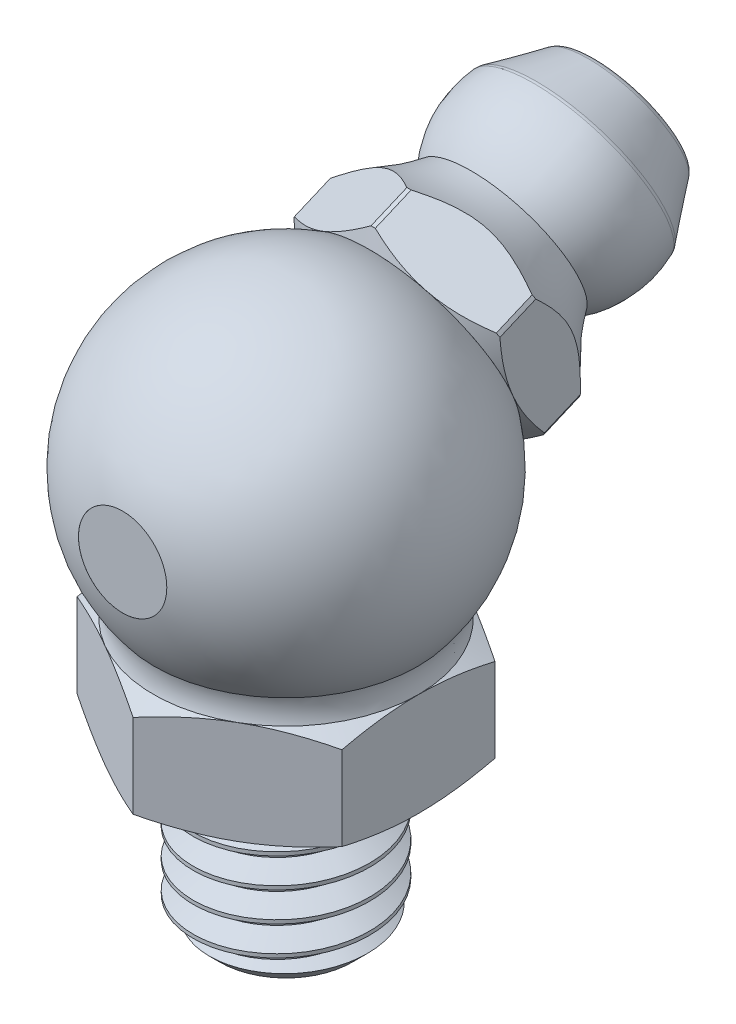
from build123d import *

# Parameters (mm, degrees)
CUT_EXTRUDE1_DEPTH      = 13.571148804
CUT_EXTRUDE1_DEPTH_BACK = 13.571148804
BOSS_EXTRUDE3_START     = -9.586907
SKETCH8_R               = 3
BOSS_EXTRUDE3_DEPTH     = 5.5
BOSS_EXTRUDE4_DEPTH     = 3.5
SKETCH13_OUTSIDE_W      = 78.666
SKETCH13_OUTSIDE_H      = 78.527
SKETCH13_OUTSIDE_R      = 4.5
CUT_EXTRUDE2_DEPTH      = 14.02426519
CUT_EXTRUDE2_DRAFT      = -65
MIRROR1_COPY_1_SKETCH_W = 78.666
MIRROR1_COPY_1_SKETCH_H = 78.527
MIRROR1_COPY_1_SKETCH_R = 4.5
MIRROR1_COPY_1_DEPTH    = 14.02426519
MIRROR1_COPY_1_DRAFT    = -65
CHAMFER1_SIZE           = 0.75
SKETCH66_R              = 1.5
CUT_EXTRUDE6_DEPTH      = 0.2
SKETCH70_OUTSIDE_W      = 19.398
SKETCH70_OUTSIDE_H      = 33.745
CUT_EXTRUDE7_DEPTH      = 18.316881175
SKETCH71_OUTSIDE_W      = 71.716
SKETCH71_OUTSIDE_H      = 86.063
SKETCH71_OUTSIDE_R      = 3.5
CUT_EXTRUDE8_DEPTH      = 18.316881175
CUT_EXTRUDE8_DRAFT      = -55
CUT_SWEEP2_PROFILE_R    = 1.25
FILLET1_R               = 0.3
CUT_SWEEP1_PITCH        = 1


with BuildPart() as part:
    # Sketch5 → Revolve2 (revolve)
    with BuildSketch(Plane(origin=(0, 0, 0), x_dir=(0, 0, -1), z_dir=(1, 0, 0))):
        with BuildLine():
            Line((0, 9.586906814), (0, -1.913093186))
            ThreePointArc((0, -1.913093186), (5.75, 3.836906814), (0, 9.586906814))
        make_face()
    revolve(axis=Axis((0, 9.586906814, 0), (0, -1, 0)))

    # Sketch6 → Cut-Extrude1 (cut, two sides: drawn at the far end of the back side and taken through both)
    with BuildSketch(Plane(origin=(0, 0, 0), x_dir=(0, 0, -1), z_dir=(1, 0, 0)).offset(-CUT_EXTRUDE1_DEPTH_BACK)):
        Polygon((3.805841977, 9.586906814), (2.515323955, 9.586906814), (5.489445816, 2.580314792), (6.779963838, 2.580314792), align=None)
    extrude(amount=CUT_EXTRUDE1_DEPTH + CUT_EXTRUDE1_DEPTH_BACK, mode=Mode.SUBTRACT)



with BuildPart() as body_2:
    # Sketch8 → Boss-Extrude3 (new body)
    with BuildSketch(Plane(origin=(0, 0, 0), x_dir=(1, 0, 0), z_dir=(0, 1, 0)).offset(BOSS_EXTRUDE3_START)):
        with Locations(Location((0, 0, 0), (0, 0, 270))):
            Circle(SKETCH8_R)
    extrude(amount=BOSS_EXTRUDE3_DEPTH)

    # Sketch9 → Boss-Extrude4 (add)
    with BuildSketch(Plane(origin=(0, -4.086906814, 0), x_dir=(1, 0, 0), z_dir=(0, 1, 0))):
        Polygon((4.5, -2.598076211), (4.5, 2.598076211), (0, 5.196152423), (-4.5, 2.598076211), (-4.5, -2.598076211), (0, -5.196152423), align=None)
    extrude(amount=BOSS_EXTRUDE4_DEPTH)


with BuildPart() as cut_extrude2_tool:
    # Sketch13 outside → Cut-Extrude2 (with draft: the straight prism first)
    with BuildSketch(Plane(origin=(0, -0.586906814, 0), x_dir=(1, 0, 0), z_dir=(0, 1, 0))):
        with Locations((0, -0.0695)):
            Rectangle(SKETCH13_OUTSIDE_W, SKETCH13_OUTSIDE_H)
        Circle(SKETCH13_OUTSIDE_R, mode=Mode.SUBTRACT)
    extrude(amount=-CUT_EXTRUDE2_DEPTH)
    # Cut-Extrude2: the draft: its side faces are tilted about the plane it starts from
    cut_extrude2_sides = [cut_extrude2_tool.faces().sort_by_distance(p)[0] for p in [
        (0, -7.599039409, 39.333),
        (39.333, -7.599039409, 0.0695),
        (0, -7.599039409, -39.194),
        (-39.333, -7.599039409, 0.0695),
        (-4.5, -7.599039409, 0),
    ]]
    draft(cut_extrude2_sides, Plane(origin=(0, -0.586906814, 0), x_dir=(1, 0, 0), z_dir=(0, 1, 0)), CUT_EXTRUDE2_DRAFT)


with BuildPart() as body_2_1:
    add(body_2.part)

    # Cut-Extrude2: cut by cut_extrude2_tool
    add(cut_extrude2_tool.part, mode=Mode.SUBTRACT)


with BuildPart() as mirror1_copy_1_tool:
    # Mirror1 copy 1 sketch → Mirror1 copy 1 (with draft: the straight prism first)
    with BuildSketch(Plane.XZ.offset(4.086906814)):
        with Locations((0, 0.0695)):
            Rectangle(MIRROR1_COPY_1_SKETCH_W, MIRROR1_COPY_1_SKETCH_H)
        Circle(MIRROR1_COPY_1_SKETCH_R, mode=Mode.SUBTRACT)
    extrude(amount=-MIRROR1_COPY_1_DEPTH)
    # Mirror1 copy 1: the draft: its side faces are tilted about the plane it starts from
    mirror1_copy_1_sides = [mirror1_copy_1_tool.faces().sort_by_distance(p)[0] for p in [
        (0, 2.925225781, 39.333),
        (39.333, 2.925225781, 0.0695),
        (0, 2.925225781, -39.194),
        (-39.333, 2.925225781, 0.0695),
        (-4.5, 2.925225781, 0),
    ]]
    draft(mirror1_copy_1_sides, Plane.XZ.offset(4.086906814), MIRROR1_COPY_1_DRAFT)


with BuildPart() as body_2_2:
    add(body_2_1.part)

    # Mirror1 copy 1: cut by mirror1_copy_1_tool
    add(mirror1_copy_1_tool.part, mode=Mode.SUBTRACT)


with BuildPart() as part_1:
    add(part.part)

    add(body_2_2.part)  # Revolve4 merges body 2
    # Sketch12 → Revolve4 (revolve)
    with BuildSketch(Plane(origin=(0, 0, 0), x_dir=(0, 0, -1), z_dir=(1, 0, 0))):
        with BuildLine():
            Line((-4.5, -0.586906814), (0, -0.586906814))
            Line((0, -0.586906814), (0, 0.961906814))
            Line((0, 0.961906814), (-4.979646072, 0.961906814))
            ThreePointArc((-4.979646072, 0.961906814), (-4.488376271, 0.265369571), (-4.5, -0.586906814))
        make_face()
    revolve(axis=Axis((0, -9.586906814, 0), (0, 1, 0)))

    # Chamfer1
    chamfer1_edges = [part_1.edges().sort_by_distance(p)[0] for p in [
        (0, -9.586907, -3),
    ]]
    chamfer(chamfer1_edges, length=CHAMFER1_SIZE)

    # Sketch66 → Cut-Extrude6 (cut)
    with BuildSketch(Plane.XY.offset(5.75)):
        with Locations((0, 3.836906814)):
            Circle(SKETCH66_R)
    extrude(amount=-CUT_EXTRUDE6_DEPTH, mode=Mode.SUBTRACT)


with BuildPart() as body_2_2_1:
    # Sketch69 → Revolve5 (revolve)
    with BuildSketch(Plane(origin=(0, 0, 0), x_dir=(0, 0, -1), z_dir=(1, 0, 0))):
        with BuildLine():
            Line((5.762333838, 1.937430901), (4.199409324, 5.619450315))
            Line((4.199409324, 5.619450315), (11.320854961, 8.642324643))
            Line((11.320854961, 8.642324643), (12.2, 6.571188723))
            Line((12.2, 6.571188723), (10.996369954, 4.973917703))
            ThreePointArc((10.996369954, 4.973917703), (9.747261742, 4.443702724), (8.390530212, 4.469756643))
            ThreePointArc((8.390530212, 4.469756643), (7.762763477, 3.579396386), (7.303385245, 2.591568414))
            Line((7.303385245, 2.591568414), (5.762333838, 1.937430901))
        make_face()
    revolve(axis=Axis((0, 5.619450315, -4.199409324), (0, 0.3907311284892714, -0.9205048534524414)))

    # Sketch70 outside → Cut-Extrude7 (cut, through all)
    with BuildSketch(Plane(origin=(0, 2.36832719, -5.579429214), x_dir=(1, 0, 0), z_dir=(0, -0.3907311284892713, 0.9205048534524414))):
        with Locations((0, -0.6685)):
            Rectangle(SKETCH70_OUTSIDE_W, SKETCH70_OUTSIDE_H)
        Polygon((3.5, 1.511165403), (3.5, 5.552617287), (0, 7.573343229), (-3.5, 5.552617287), (-3.5, 1.511165403), (0, -0.50956054), align=None, mode=Mode.SUBTRACT)
    extrude(amount=-CUT_EXTRUDE7_DEPTH, mode=Mode.SUBTRACT)


with BuildPart() as cut_extrude8_tool:
    # Sketch71 outside → Cut-Extrude8 (with draft: the straight prism first)
    with BuildSketch(Plane(origin=(0, 2.36832719, -5.579429214), x_dir=(1, 0, 0), z_dir=(0, -0.3907311284892717, 0.9205048534524412))):
        with Locations((0, -0.6685)):
            Rectangle(SKETCH71_OUTSIDE_W, SKETCH71_OUTSIDE_H)
        with Locations((0, 3.531891345)):
            Circle(SKETCH71_OUTSIDE_R, mode=Mode.SUBTRACT)
    extrude(amount=-CUT_EXTRUDE8_DEPTH)
    # Cut-Extrude8: the draft: its side faces are tilted about the plane it starts from
    cut_extrude8_sides = [cut_extrude8_tool.faces().sort_by_distance(p)[0] for p in [
        (0, -34.27924708, -31.08476854),
        (35.858, 5.331457522, -14.271021985),
        (0, 44.942162123, 2.542724571),
        (-35.858, 5.331457522, -14.271021985),
        (-3.5, 9.197938141, -12.629798334),
    ]]
    draft(cut_extrude8_sides, Plane(origin=(0, 2.36832719, -5.579429214), x_dir=(1, 0, 0), z_dir=(0, -0.3907311284892717, 0.9205048534524412)), CUT_EXTRUDE8_DRAFT)


with BuildPart() as body_2_2_2:
    add(body_2_2_1.part)

    # Cut-Extrude8: cut by cut_extrude8_tool
    add(cut_extrude8_tool.part, mode=Mode.SUBTRACT)


with BuildPart() as cut_sweep2_tool:
    # Cut-Sweep2: sweep along a path in Sketch72
    with BuildLine(Plane(origin=(0, 0, 0), x_dir=(0, 0, -1), z_dir=(1, 0, 0))) as cut_sweep2_path:
        Line((12.2, 9.015499572), (1.827806615, 4.612764691))
        ThreePointArc((1.827806615, 4.612764691), (0.498342534, 3.507061086), (0, 1.851250131))
        Line((0, 1.851250131), (0, -9.586906814))
    # Cut-Sweep2 profile (on start of the path) → Cut-Sweep2 (sweep)
    with BuildSketch(Plane(origin=(0, 9.015499572, -12.2), x_dir=(0, 0.9205048534524412, 0.39073112848927183), z_dir=(0, -0.39073112848927183, 0.9205048534524412))):
        Circle(CUT_SWEEP2_PROFILE_R)
    sweep(path=cut_sweep2_path.line)


with BuildPart() as part_2:
    add(part_1.part)

    # Cut-Sweep2: cut by cut_sweep2_tool
    add(cut_sweep2_tool.part, mode=Mode.SUBTRACT)

    # Cut-Sweep1: the profile of Sketch68 profile screwed along a right-hand helix of 6.5 turns, 8 arcs to a turn; built about Z, then put on its axis
    cut_sweep1_z = Axis((0, 0, 0), (0, 0, 1))
    cut_sweep1_corners = [(3.0003, 0, 0.000173205), (3.0003, 0, -0.875173205), (2.350480947, 0, -0.5), (2.350480947, 0, -0.375)]
    with BuildLine(mode=Mode.PRIVATE) as cut_sweep1_profile:
        Line(cut_sweep1_corners[0], cut_sweep1_corners[1])
        Line(cut_sweep1_corners[1], cut_sweep1_corners[2])
        Line(cut_sweep1_corners[2], cut_sweep1_corners[3])
        Line(cut_sweep1_corners[3], cut_sweep1_corners[0])
    cut_sweep1_cap = Face(cut_sweep1_profile.wire())
    cut_sweep1_turn_angles = [0, 22.5, 45, 67.5, 90, 112.5, 135, 157.5, 180, 202.5, 225, 247.5, 270, 292.5, 315, 337.5, 360]
    cut_sweep1_turn_weights = [1, 0.9238795325112867, 1, 0.9238795325112867, 1, 0.9238795325112867, 1, 0.9238795325112867, 1, 0.9238795325112867, 1, 0.9238795325112867, 1, 0.9238795325112867, 1, 0.9238795325112867, 1]
    cut_sweep1_turn_rails = [Edge.make_bspline([Vector(p[0], p[1], 0).rotate(cut_sweep1_z, cut_sweep1_turn_angles[k]) / cut_sweep1_turn_weights[k] + Vector(0, 0, p[2] + CUT_SWEEP1_PITCH * cut_sweep1_turn_angles[k] / 360) for k in range(17)], [0, 0, 0, 1, 1, 2, 2, 3, 3, 4, 4, 5, 5, 6, 6, 7, 7, 8, 8, 8], 2, cut_sweep1_turn_weights) for p in cut_sweep1_corners]
    cut_sweep1_turn_sides = [Face.make_surface_from_curves(cut_sweep1_turn_rails[p[0]], cut_sweep1_turn_rails[p[1]]) for p in [(0, 1), (1, 2), (2, 3), (3, 0)]]
    cut_sweep1_last_angles = [2160, 2182.5, 2205, 2227.5, 2250, 2272.5, 2295, 2317.5, 2340]
    cut_sweep1_last_weights = [1, 0.9238795325112867, 1, 0.9238795325112867, 1, 0.9238795325112867, 1, 0.923879532511261, 1]
    cut_sweep1_last_rails = [Edge.make_bspline([Vector(p[0], p[1], 0).rotate(cut_sweep1_z, cut_sweep1_last_angles[k]) / cut_sweep1_last_weights[k] + Vector(0, 0, p[2] + CUT_SWEEP1_PITCH * cut_sweep1_last_angles[k] / 360) for k in range(9)], [0, 0, 0, 1, 1, 2, 2, 3, 3, 4, 4, 4], 2, cut_sweep1_last_weights) for p in cut_sweep1_corners]
    cut_sweep1_last_sides = [Face.make_surface_from_curves(cut_sweep1_last_rails[p[0]], cut_sweep1_last_rails[p[1]]) for p in [(0, 1), (1, 2), (2, 3), (3, 0)]]
    cut_sweep1 = Plane(origin=(0, -9.586906814, 0), x_dir=(0, 0, 1), z_dir=(0, 1, 0)) * Solid(Shell([*[p.moved(Location((0, 0, CUT_SWEEP1_PITCH * i))) for i in range(6) for p in cut_sweep1_turn_sides], *cut_sweep1_last_sides, cut_sweep1_cap, cut_sweep1_cap.rotate(cut_sweep1_z, 2340).moved(Location((0, 0, CUT_SWEEP1_PITCH * 2340 / 360)))]))
    add(cut_sweep1, mode=Mode.SUBTRACT)


with BuildPart() as body_2_2_3:
    add(body_2_2_2.part)

    # Cut-Sweep2: cut by cut_sweep2_tool
    add(cut_sweep2_tool.part, mode=Mode.SUBTRACT)

    # Fillet1
    fillet1_edges = [body_2_2_3.edges().sort_by_distance(p)[0] for p in [
        (0, 10.713460563, -10.441709922),
        (0, 10.95719925, -8.456617619),
    ]]
    fillet(fillet1_edges, radius=FILLET1_R)


with BuildPart() as body_3:
    # Sketch85 → Revolve6 (revolve)
    with BuildSketch(Plane(origin=(0, 0, 0), x_dir=(0, 0, -1), z_dir=(1, 0, 0))):
        with BuildLine():
            Line((9.019592827, 7.665496822), (11.320854961, 8.642324643))
            ThreePointArc((11.320854961, 8.642324643), (10.658637805, 7.003279666), (9.019592827, 7.665496822))
        make_face()
    revolve(axis=Axis((0, 5.619450315, -4.199409324), (0, 0.39073112848927133, -0.9205048534524414)))


solid = Compound([part_2.part, body_2_2_3.part, body_3.part])
